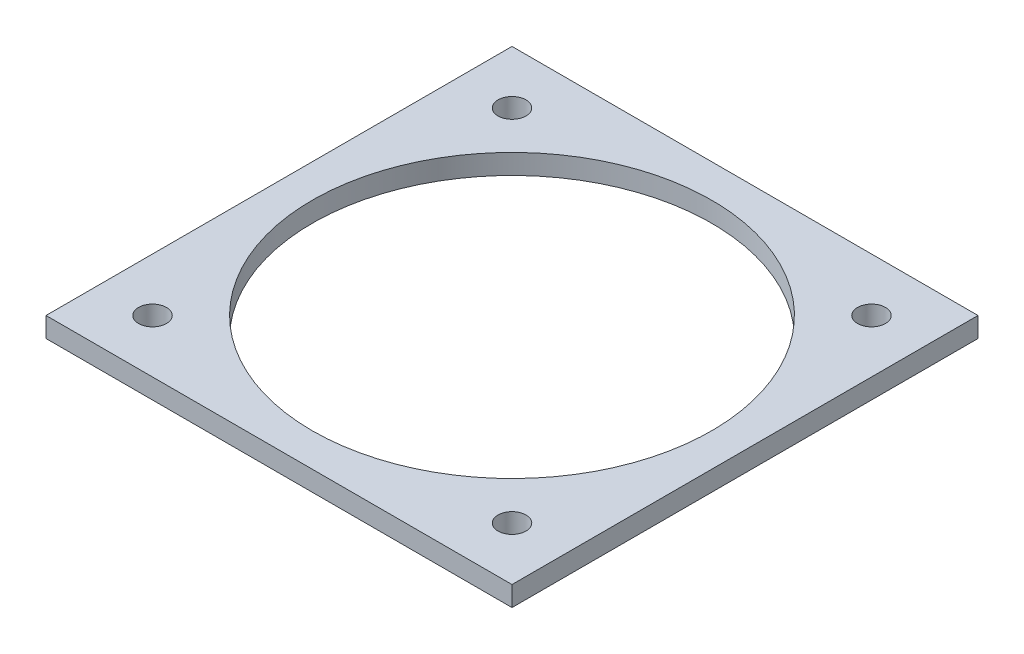
from build123d import *

# Parameters (mm, degrees)
SKETCH_1_W               = 70
SKETCH_1_H               = 70
SKETCH_1_R               = 30
EXTRUDE_1_DEPTH          = 3
SKETCH_2_R               = 2.1
CUT_EXTRUDE_1_DEPTH      = 10
PATTERN_CIRCULAR_1_COUNT = 4


with BuildPart() as part:
    # 草图1 → 凸台-拉伸1 (new body)
    with BuildSketch(Plane(origin=(0, 0, 0), x_dir=(1, 0, 0), z_dir=(0, 1, 0))):
        Rectangle(SKETCH_1_W, SKETCH_1_H)
        Circle(SKETCH_1_R, mode=Mode.SUBTRACT)
    extrude(amount=EXTRUDE_1_DEPTH)

    # 草图2 → 切除-拉伸1 (cut)
    with BuildSketch(Plane(origin=(0, 3, 0), x_dir=(1, 0, 0), z_dir=(0, 1, 0))):
        with Locations((27, 27)):
            Circle(SKETCH_2_R)
    cut_extrude_1 = extrude(amount=-CUT_EXTRUDE_1_DEPTH, mode=Mode.SUBTRACT)

    # 阵列(圆周)1: 切除-拉伸1 ×4 about axis
    pattern_circular_1_axis = Axis((0, 3, 0), (0, -1, 0))
    for i in range(1, PATTERN_CIRCULAR_1_COUNT):
        add(cut_extrude_1.rotate(pattern_circular_1_axis, i * 360 / PATTERN_CIRCULAR_1_COUNT), mode=Mode.SUBTRACT)


solid = part.part
